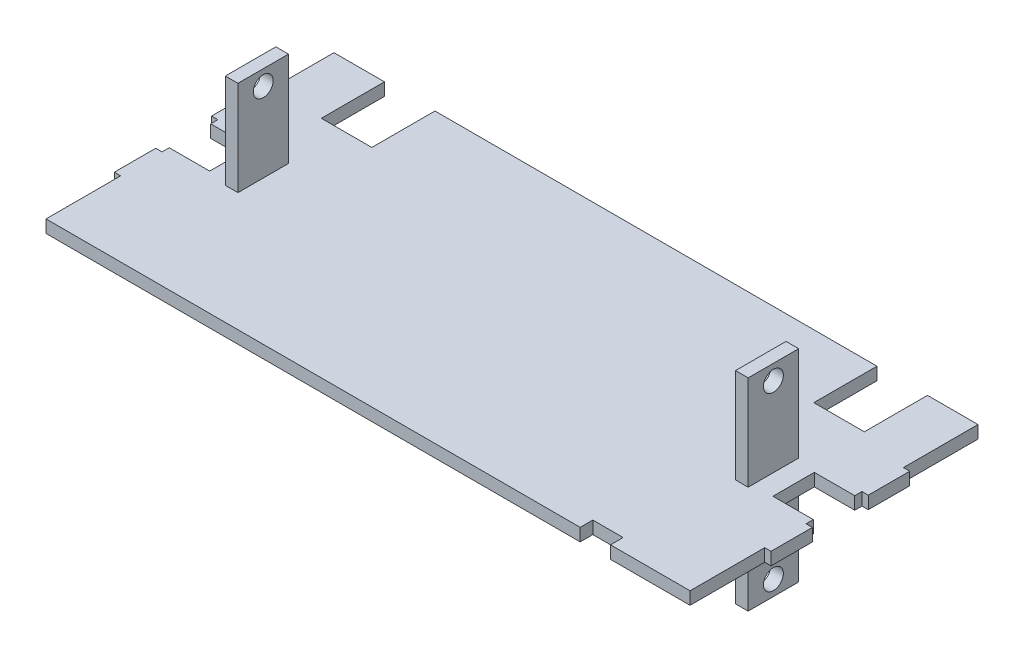
from build123d import *

# Parameters (mm, degrees)
BOSS_EXTRUDE1_DEPTH     = 3.175
SKETCH2_W               = 6.35
SKETCH2_H               = 25.4
BOSS_EXTRUDE2_DEPTH     = 50.8
CUT_EXTRUDE1_DEPTH      = 310.45094785
CUT_EXTRUDE1_DEPTH_BACK = 310.45094785
SKETCH3_R               = 5.0038


with BuildPart() as part:
    # Sketch1 → Boss-Extrude1 (new, symmetric)
    with BuildSketch(Plane(origin=(0, 0, 0), x_dir=(1, 0, 0), z_dir=(0, 1, 0))):
        Polygon((161.925, -72.39), (121.92, -72.39), (121.92, -66.04), (106.68, -66.04), (106.68, -72.39), (-161.925, -72.39), (-161.925, -34.874677354), (-165.1, -34.874677354), (-165.1, -14.046677354), (-161.925, -14.046677354), (-161.925, -10.414), (-141.605, -10.414), (-141.605, 10.414), (-161.925, 10.414), (-161.925, 14.046677354), (-165.1, 14.046677354), (-165.1, 34.874677354), (-161.925, 34.874677354), (-161.925, 72.39), (-136.525, 72.39), (-136.525, 40.64), (-111.125, 40.64), (-111.125, 72.39), (111.125, 72.39), (111.125, 40.64), (136.525, 40.64), (136.525, 72.39), (161.925, 72.39), (161.925, 34.874677354), (165.1, 34.874677354), (165.1, 14.046677354), (161.925, 14.046677354), (161.925, 10.414), (141.605, 10.414), (141.605, -10.414), (161.925, -10.414), (161.925, -14.046677354), (165.1, -14.046677354), (165.1, -34.874677354), (161.925, -34.874677354), align=None)
    extrude(amount=BOSS_EXTRUDE1_DEPTH, both=True)

    # Sketch2 → Boss-Extrude2 (add, symmetric)
    with BuildSketch(Plane(origin=(0, 0, 0), x_dir=(1, 0, 0), z_dir=(0, 1, 0))):
        with Locations((128.27, 0)):
            Rectangle(SKETCH2_W, SKETCH2_H)
        with Locations((-128.27, 0)):
            Rectangle(SKETCH2_W, SKETCH2_H)
    extrude(amount=BOSS_EXTRUDE2_DEPTH, both=True)

    # Sketch3 → Cut-Extrude1 (cut, two sides: drawn at the far end of the back side and taken through both)
    with BuildSketch(Plane.ZY.offset(131.445).offset(-CUT_EXTRUDE1_DEPTH_BACK)):
        with Locations((0, 43.18)):
            Circle(SKETCH3_R)
        with Locations((0, -43.18)):
            Circle(SKETCH3_R)
    extrude(amount=CUT_EXTRUDE1_DEPTH + CUT_EXTRUDE1_DEPTH_BACK, mode=Mode.SUBTRACT)


solid = part.part
